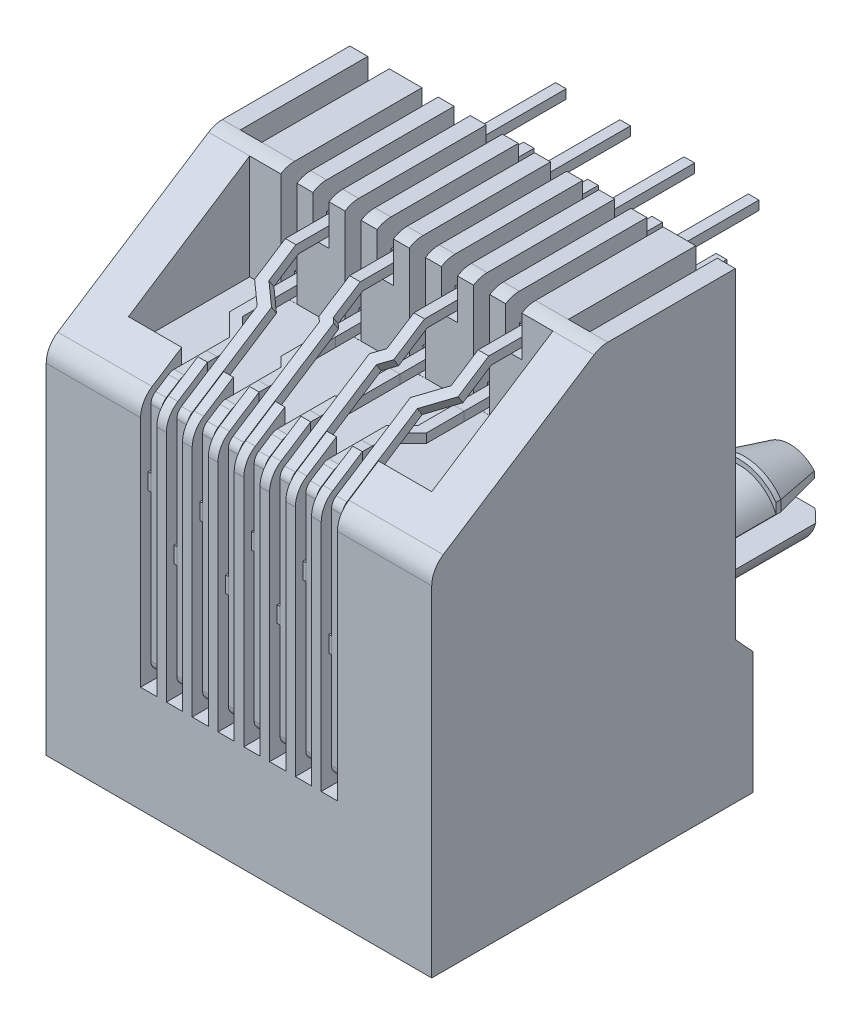
from build123d import *
from OCP.BRepFilletAPI import BRepFilletAPI_MakeChamfer

# Parameters (mm, degrees)
EXTRUDE_1_DEPTH            = 7.62
EXTRUDE_1_DEPTH_BACK       = 7.62
EXTRUDE_2_DEPTH            = 4.064
EXTRUDE_3_DEPTH            = 2
CUT_EXTRUDE_2_REACH        = 27.506
CHAMFER_1_SIZE             = 1.8
CHAMFER_1_SIZE2            = 0.482308546
CHAMFER_2_SIZE             = 0.5
SKETCH_5_W                 = 11.9888
SKETCH_5_H                 = 4.792315829
CUT_EXTRUDE_3_DEPTH        = 4.3
CUT_EXTRUDE_4_DEPTH        = 12.3878
CUT_EXTRUDE_5_DEPTH        = 2.0066
SKETCH_8_W                 = 2.3622
SKETCH_8_H                 = 4.1656
CUT_EXTRUDE_6_DEPTH        = 2.4384
CUT_EXTRUDE_7_REACH        = 25.163
SKETCH_9_W                 = 0.64
SKETCH_9_H                 = 4.297
SKETCH_9_H_2               = 1.757
CUT_EXTRUDE_8_REACH        = 27.506
SKETCH_10_W                = 0.64
SKETCH_10_H                = 10.823006421
CHAMFER_3_SIZE             = 1.03
CHAMFER_3_SIZE2            = 1.44186414
CUT_EXTRUDE_START          = -1.7272
SKETCH_11_W                = 1.1176
SKETCH_11_H                = 2.674589003
CUT_EXTRUDE_9_DEPTH        = 1.7272
SKETCH_12_W                = 2.2352
SKETCH_12_H                = 5.08
CUT_EXTRUDE_10_DEPTH       = 0.3
SKETCH_13_W                = 0.85
SKETCH_13_H                = 7.62
CUT_EXTRUDE_11_DEPTH       = 5.038415
SKETCH_14_W                = 12.7508
SKETCH_14_H                = 2.8702
CUT_EXTRUDE_12_DEPTH       = 10
EXTRUDE_4_DEPTH            = 0.15
PATTERN_LINEAR_1_COUNT     = 5
PATTERN_LINEAR_1_PITCH     = 1.02
PATTERN_LINEAR_1_COL_COUNT = 5
PATTERN_LINEAR_1_COL_PITCH = 1.02
SKETCH_16_W                = 0.1896
SKETCH_16_H                = 1.5494
EXTRUDE_5_DEPTH            = 8.7048
SKETCH_17_W                = 1.7898
SKETCH_17_H                = 1.0541
EXTRUDE_6_DEPTH            = 2.3878
CUT_EXTRUDE_START_2        = 9.5
SKETCH_19_W                = 0.64
SKETCH_19_H                = 0.9652
CUT_EXTRUDE_13_DEPTH       = 1.5
EXTRUDE_START              = 2.55
EXTRUDE_11_DEPTH           = 0.21
PATTERN_LINEAR_2_COUNT     = 4
PATTERN_LINEAR_2_PITCH     = 2.04
EXTRUDE_12_DEPTH           = 0.18
EXTRUDE_12_2_DEPTH         = 0.18
EXTRUDE_12_3_DEPTH         = 0.18
EXTRUDE_12_4_DEPTH         = 0.18
EXTRUDE_15_DEPTH           = 0.18
EXTRUDE_15_2_DEPTH         = 0.18
EXTRUDE_15_3_DEPTH         = 0.18
EXTRUDE_15_4_DEPTH         = 0.18
EXTRUDE_START_2            = -3.57
EXTRUDE_16_DEPTH           = 0.21
PATTERN_LINEAR_3_COUNT     = 4
PATTERN_LINEAR_3_PITCH     = 2.04
EXTRUDE_17_DEPTH           = 0.21
PATTERN_LINEAR_4_COUNT     = 4
PATTERN_LINEAR_4_PITCH     = 2.54
EXTRUDE_18_DEPTH           = 0.36
SKETCH_27_W                = 0.64
SKETCH_27_H                = 0.64
EXTRUDE_20_DEPTH           = 0.36
EXTRUDE_20_2_DEPTH         = 0.36
EXTRUDE_20_3_DEPTH         = 0.36
EXTRUDE_20_4_DEPTH         = 0.36
SKETCH_28_W                = 0.64
SKETCH_28_H                = 0.64
EXTRUDE_22_DEPTH           = 0.36
EXTRUDE_22_2_DEPTH         = 0.36
EXTRUDE_22_3_DEPTH         = 0.36
EXTRUDE_22_4_DEPTH         = 0.36
EXTRUDE_22_5_DEPTH         = 0.36
EXTRUDE_22_6_DEPTH         = 0.36
EXTRUDE_22_7_DEPTH         = 0.36
EXTRUDE_22_8_DEPTH         = 0.36
EXTRUDE_23_DEPTH           = 4.572


with BuildPart() as part:
    # Эскиз1 → Бобышка-Вытянуть1 (new, two sides: drawn at the far end of the back side and taken through both)
    with BuildSketch(Plane(origin=(0, 0, 0), x_dir=(0, 0, -1), z_dir=(1, 0, 0)).offset(-EXTRUDE_1_DEPTH_BACK)):
        with BuildLine():
            Line((0, 0), (-12.7, 0))
            Line((-12.7, 0), (-12.7, 13.426295429))
            ThreePointArc((-12.7, 13.426295429), (-12.578541079, 13.90396223), (-12.243668856, 14.265595242))
            Line((-12.243668856, 14.265595242), (-6.282084171, 18.127299813))
            ThreePointArc((-6.282084171, 18.127299813), (-6.021876236, 18.246983788), (-5.738415315, 18.288))
            Line((-5.738415315, 18.288), (-0.7, 18.288))
            Line((-0.7, 18.288), (-0.7, 5.588))
            Line((-0.7, 5.588), (0, 4.826))
            Line((0, 4.826), (0, 0))
        make_face()
    extrude(amount=EXTRUDE_1_DEPTH + EXTRUDE_1_DEPTH_BACK)

    # Эскиз2 → Бобышка-Вытянуть2 (add)
    with BuildSketch(Plane(origin=(0, 0, 0.7), x_dir=(-1, 0, 0), z_dir=(0, 0, -1))):
        with BuildLine():
            ThreePointArc((-7.165, 7.386081306), (-5.715, 6.426), (-4.265, 7.386081306))
            ThreePointArc((-4.265, 7.386081306), (-5.715, 9.576), (-7.165, 7.386081306))
        make_face()
        with BuildLine():
            ThreePointArc((4.265, 7.386081306), (5.715, 6.426), (7.165, 7.386081306))
            ThreePointArc((7.165, 7.386081306), (5.715, 9.576), (4.265, 7.386081306))
        make_face()
    extrude(amount=EXTRUDE_2_DEPTH)

    # Эскиз3 → Бобышка-Вытянуть3 (add)
    with BuildSketch(Plane(origin=(0, 0, -3.364), x_dir=(-1, 0, 0), z_dir=(0, 0, -1))):
        with BuildLine():
            Line((-7.49, 8.001), (-5.715, 8.001))
            Line((-5.715, 8.001), (-3.94, 8.001))
            ThreePointArc((-3.94, 8.001), (-5.715, 9.776), (-7.49, 8.001))
        make_face()
        with BuildLine():
            Line((5.715, 8.001), (3.94, 8.001))
            ThreePointArc((3.94, 8.001), (5.715, 9.776), (7.49, 8.001))
            Line((7.49, 8.001), (5.715, 8.001))
        make_face()
    extrude(amount=-EXTRUDE_3_DEPTH)

    # Вырез-Вытянуть2: up to this face of the body (flat: up to its plane)
    cut_extrude_2_end = Plane(part.part.faces().sort_by_distance((0, 12.282809859, 0.7))[0])
    # Эскиз4 → Вырез-Вытянуть2 (cut, up to the picked face)
    with BuildSketch(Plane(origin=(0, 0, -3.364), x_dir=(-1, 0, 0), z_dir=(0, 0, -1)), mode=Mode.PRIVATE) as cut_extrude_2_sk1:
        Polygon((7.62, 7.601), (7.238359774, 7.601), (4.191640226, 7.601), (3.760512716, 7.601), (3.760512716, 9.536231902), (4.265, 9.536231902), (4.265, 8.601), (7.165, 8.601), (7.165, 9.776), (7.62, 9.776), align=None)
    cut_extrude_2_tool1 = split(extrude(cut_extrude_2_sk1.sketch, amount=-CUT_EXTRUDE_2_REACH, mode=Mode.PRIVATE), bisect_by=cut_extrude_2_end, keep=Keep.BOTH, mode=Mode.PRIVATE)
    # Эскиз4 → Вырез-Вытянуть2 (cut, up to the picked face)
    with BuildSketch(Plane(origin=(0, 0, -3.364), x_dir=(-1, 0, 0), z_dir=(0, 0, -1)), mode=Mode.PRIVATE) as cut_extrude_2_sk2:
        Polygon((-7.238359774, 7.601), (-4.191640226, 7.601), (-3.760512716, 7.601), (-3.760512716, 9.536231902), (-4.265, 9.536231902), (-4.265, 8.601), (-7.165, 8.601), (-7.165, 9.776), (-7.62, 9.776), (-7.62, 7.601), align=None)
    cut_extrude_2_tool2 = split(extrude(cut_extrude_2_sk2.sketch, amount=-CUT_EXTRUDE_2_REACH, mode=Mode.PRIVATE), bisect_by=cut_extrude_2_end, keep=Keep.BOTH, mode=Mode.PRIVATE)
    add(cut_extrude_2_tool1.solids().sort_by(Axis((-5.714629, 8.314307, -3.364), (0, 0, 1)))[0], mode=Mode.SUBTRACT)
    add(cut_extrude_2_tool2.solids().sort_by(Axis((5.714629, 8.314307, -3.364), (0, 0, 1)))[0], mode=Mode.SUBTRACT)

    # Фаска1: one chamfer whose edges measure the first distance from different faces: ONE call of the kernel's chamfer builder (chamfer() names one face for all edges)
    chamfer_1_edges_1 = [part.edges().sort_by_distance(p)[0] for p in [
        (-5.715, 9.776, -3.364),
    ]]
    chamfer_1_side_1 = [part.faces().sort_by_distance(p)[0] for p in [
        (-5.715, 9.776, -2.364),
    ]]
    chamfer_1_edges_2 = [part.edges().sort_by_distance(p)[0] for p in [
        (-7.165, 8.812889881, -3.364),
    ]]
    chamfer_1_side_2 = [part.faces().sort_by_distance(p)[0] for p in [
        (-7.165, 8.805723204, -2.29276462),
    ]]
    chamfer_1_edges_3 = [part.edges().sort_by_distance(p)[0] for p in [
        (-4.265, 8.812889881, -3.364),
    ]]
    chamfer_1_side_3 = [part.faces().sort_by_distance(p)[0] for p in [
        (-4.265, 8.805723204, -2.29276462),
    ]]
    chamfer_1_edges_4 = [part.edges().sort_by_distance(p)[0] for p in [
        (5.715, 9.776, -3.364),
    ]]
    chamfer_1_side_4 = [part.faces().sort_by_distance(p)[0] for p in [
        (5.715, 9.776, -2.364),
    ]]
    chamfer_1_edges_5 = [part.edges().sort_by_distance(p)[0] for p in [
        (4.265, 8.812889881, -3.364),
    ]]
    chamfer_1_side_5 = [part.faces().sort_by_distance(p)[0] for p in [
        (4.265, 8.805723204, -2.29276462),
    ]]
    chamfer_1_edges_6 = [part.edges().sort_by_distance(p)[0] for p in [
        (7.165, 8.812889881, -3.364),
    ]]
    chamfer_1_side_6 = [part.faces().sort_by_distance(p)[0] for p in [
        (7.165, 8.805723204, -2.29276462),
    ]]
    chamfer_1 = BRepFilletAPI_MakeChamfer(part.part.solid().wrapped)
    for e in chamfer_1_edges_1:
        chamfer_1.Add(CHAMFER_1_SIZE, CHAMFER_1_SIZE2, e.wrapped, chamfer_1_side_1[0].wrapped)  # the first distance lies on this face
    for e in chamfer_1_edges_2:
        chamfer_1.Add(CHAMFER_1_SIZE, CHAMFER_1_SIZE2, e.wrapped, chamfer_1_side_2[0].wrapped)  # the first distance lies on this face
    for e in chamfer_1_edges_3:
        chamfer_1.Add(CHAMFER_1_SIZE, CHAMFER_1_SIZE2, e.wrapped, chamfer_1_side_3[0].wrapped)  # the first distance lies on this face
    for e in chamfer_1_edges_4:
        chamfer_1.Add(CHAMFER_1_SIZE, CHAMFER_1_SIZE2, e.wrapped, chamfer_1_side_4[0].wrapped)  # the first distance lies on this face
    for e in chamfer_1_edges_5:
        chamfer_1.Add(CHAMFER_1_SIZE, CHAMFER_1_SIZE2, e.wrapped, chamfer_1_side_5[0].wrapped)  # the first distance lies on this face
    for e in chamfer_1_edges_6:
        chamfer_1.Add(CHAMFER_1_SIZE, CHAMFER_1_SIZE2, e.wrapped, chamfer_1_side_6[0].wrapped)  # the first distance lies on this face
    add(Compound.cast(chamfer_1.Shape()), mode=Mode.REPLACE)

    # Фаска2
    chamfer_2_edges = [part.edges().sort_by_distance(p)[0] for p in [
        (-5.715, 6.426, -3.364),
        (5.715, 6.426, -3.364),
    ]]
    chamfer(chamfer_2_edges, length=CHAMFER_2_SIZE)

    # Эскиз5 → Вырез-Вытянуть3 (cut)
    with BuildSketch(Plane(origin=(0, 18.288, 0), x_dir=(1, 0, 0), z_dir=(0, 1, 0))):
        with Locations((0, -8.678242086)):
            Rectangle(SKETCH_5_W, SKETCH_5_H)
    extrude(amount=-CUT_EXTRUDE_3_DEPTH, mode=Mode.SUBTRACT)

    # Эскиз6 → Вырез-Вытянуть4 (cut)
    with BuildSketch(Plane.XZ):
        Polygon((-6.0198, 10.4902), (-4.4196, 10.4902), (-4.4196, 12.0396), (4.4196, 12.0396), (4.4196, 10.4902), (6.0198, 10.4902), (6.0198, 3.4036), (3.1242, 3.4036), (3.1242, 1.7272), (-3.1242, 1.7272), (-3.1242, 3.4036), (-6.0198, 3.4036), align=None)
    extrude(amount=-CUT_EXTRUDE_4_DEPTH, mode=Mode.SUBTRACT)

    # Эскиз7 → Вырез-Вытянуть5 (cut, symmetric)
    with BuildSketch(Plane(origin=(0, 0, 0), x_dir=(0, 0, -1), z_dir=(1, 0, 0))):
        Polygon((-0.5842, 1.524), (-0.5842, 2.909935566), (-1.7272, 7.4168), (-1.7272, 0), (-0.3302, 0), align=None)
    extrude(amount=CUT_EXTRUDE_5_DEPTH, both=True, mode=Mode.SUBTRACT)

    # Эскиз8 → Вырез-Вытянуть6 (cut)
    with BuildSketch(Plane(origin=(0, 0, 0), x_dir=(-1, 0, 0), z_dir=(0, 0, -1))):
        with Locations((5.4737, 3.5052)):
            Rectangle(SKETCH_8_W, SKETCH_8_H)
        with Locations((-5.4737, 3.5052)):
            Rectangle(SKETCH_8_W, SKETCH_8_H)
    extrude(amount=-CUT_EXTRUDE_6_DEPTH, mode=Mode.SUBTRACT)

    # Вырез-Вытянуть7: up to this face of the body (flat: up to its plane)
    cut_extrude_7_end = Plane(part.part.faces().sort_by_distance((0, 16.057649906, 6.282084171))[0])
    # Эскиз9 → Вырез-Вытянуть7 (cut, up to the picked face)
    with BuildSketch(Plane(origin=(0, 0, 0.7), x_dir=(-1, 0, 0), z_dir=(0, 0, -1)), mode=Mode.PRIVATE) as cut_extrude_7_sk1:
        with Locations((-3.175, 16.1395)):
            Rectangle(SKETCH_9_W, SKETCH_9_H)
    cut_extrude_7_tool1 = split(extrude(cut_extrude_7_sk1.sketch, amount=-CUT_EXTRUDE_7_REACH, mode=Mode.PRIVATE), bisect_by=cut_extrude_7_end, keep=Keep.BOTH, mode=Mode.PRIVATE)
    # Эскиз9 → Вырез-Вытянуть7 (cut, up to the picked face)
    with BuildSketch(Plane(origin=(0, 0, 0.7), x_dir=(-1, 0, 0), z_dir=(0, 0, -1)), mode=Mode.PRIVATE) as cut_extrude_7_sk2:
        with Locations((-0.635, 16.1395)):
            Rectangle(SKETCH_9_W, SKETCH_9_H)
    cut_extrude_7_tool2 = split(extrude(cut_extrude_7_sk2.sketch, amount=-CUT_EXTRUDE_7_REACH, mode=Mode.PRIVATE), bisect_by=cut_extrude_7_end, keep=Keep.BOTH, mode=Mode.PRIVATE)
    # Эскиз9 → Вырез-Вытянуть7 (cut, up to the picked face)
    with BuildSketch(Plane(origin=(0, 0, 0.7), x_dir=(-1, 0, 0), z_dir=(0, 0, -1)), mode=Mode.PRIVATE) as cut_extrude_7_sk3:
        with Locations((1.905, 16.1395)):
            Rectangle(SKETCH_9_W, SKETCH_9_H)
    cut_extrude_7_tool3 = split(extrude(cut_extrude_7_sk3.sketch, amount=-CUT_EXTRUDE_7_REACH, mode=Mode.PRIVATE), bisect_by=cut_extrude_7_end, keep=Keep.BOTH, mode=Mode.PRIVATE)
    # Эскиз9 → Вырез-Вытянуть7 (cut, up to the picked face)
    with BuildSketch(Plane(origin=(0, 0, 0.7), x_dir=(-1, 0, 0), z_dir=(0, 0, -1)), mode=Mode.PRIVATE) as cut_extrude_7_sk4:
        with Locations((-1.905, 17.4095)):
            Rectangle(SKETCH_9_W, SKETCH_9_H_2)
    cut_extrude_7_tool4 = split(extrude(cut_extrude_7_sk4.sketch, amount=-CUT_EXTRUDE_7_REACH, mode=Mode.PRIVATE), bisect_by=cut_extrude_7_end, keep=Keep.BOTH, mode=Mode.PRIVATE)
    # Эскиз9 → Вырез-Вытянуть7 (cut, up to the picked face)
    with BuildSketch(Plane(origin=(0, 0, 0.7), x_dir=(-1, 0, 0), z_dir=(0, 0, -1)), mode=Mode.PRIVATE) as cut_extrude_7_sk5:
        with Locations((4.445, 16.1395)):
            Rectangle(SKETCH_9_W, SKETCH_9_H)
    cut_extrude_7_tool5 = split(extrude(cut_extrude_7_sk5.sketch, amount=-CUT_EXTRUDE_7_REACH, mode=Mode.PRIVATE), bisect_by=cut_extrude_7_end, keep=Keep.BOTH, mode=Mode.PRIVATE)
    # Эскиз9 → Вырез-Вытянуть7 (cut, up to the picked face)
    with BuildSketch(Plane(origin=(0, 0, 0.7), x_dir=(-1, 0, 0), z_dir=(0, 0, -1)), mode=Mode.PRIVATE) as cut_extrude_7_sk6:
        with Locations((-4.445, 17.4095)):
            Rectangle(SKETCH_9_W, SKETCH_9_H_2)
    cut_extrude_7_tool6 = split(extrude(cut_extrude_7_sk6.sketch, amount=-CUT_EXTRUDE_7_REACH, mode=Mode.PRIVATE), bisect_by=cut_extrude_7_end, keep=Keep.BOTH, mode=Mode.PRIVATE)
    # Эскиз9 → Вырез-Вытянуть7 (cut, up to the picked face)
    with BuildSketch(Plane(origin=(0, 0, 0.7), x_dir=(-1, 0, 0), z_dir=(0, 0, -1)), mode=Mode.PRIVATE) as cut_extrude_7_sk7:
        with Locations((0.635, 17.4095)):
            Rectangle(SKETCH_9_W, SKETCH_9_H_2)
    cut_extrude_7_tool7 = split(extrude(cut_extrude_7_sk7.sketch, amount=-CUT_EXTRUDE_7_REACH, mode=Mode.PRIVATE), bisect_by=cut_extrude_7_end, keep=Keep.BOTH, mode=Mode.PRIVATE)
    # Эскиз9 → Вырез-Вытянуть7 (cut, up to the picked face)
    with BuildSketch(Plane(origin=(0, 0, 0.7), x_dir=(-1, 0, 0), z_dir=(0, 0, -1)), mode=Mode.PRIVATE) as cut_extrude_7_sk8:
        with Locations((3.175, 17.4095)):
            Rectangle(SKETCH_9_W, SKETCH_9_H_2)
    cut_extrude_7_tool8 = split(extrude(cut_extrude_7_sk8.sketch, amount=-CUT_EXTRUDE_7_REACH, mode=Mode.PRIVATE), bisect_by=cut_extrude_7_end, keep=Keep.BOTH, mode=Mode.PRIVATE)
    add(cut_extrude_7_tool1.solids().sort_by(Axis((3.175, 16.1395, 0.7), (0, 0, 1)))[0], mode=Mode.SUBTRACT)
    add(cut_extrude_7_tool2.solids().sort_by(Axis((0.635, 16.1395, 0.7), (0, 0, 1)))[0], mode=Mode.SUBTRACT)
    add(cut_extrude_7_tool3.solids().sort_by(Axis((-1.905, 16.1395, 0.7), (0, 0, 1)))[0], mode=Mode.SUBTRACT)
    add(cut_extrude_7_tool4.solids().sort_by(Axis((1.905, 17.4095, 0.7), (0, 0, 1)))[0], mode=Mode.SUBTRACT)
    add(cut_extrude_7_tool5.solids().sort_by(Axis((-4.445, 16.1395, 0.7), (0, 0, 1)))[0], mode=Mode.SUBTRACT)
    add(cut_extrude_7_tool6.solids().sort_by(Axis((4.445, 17.4095, 0.7), (0, 0, 1)))[0], mode=Mode.SUBTRACT)
    add(cut_extrude_7_tool7.solids().sort_by(Axis((-0.635, 17.4095, 0.7), (0, 0, 1)))[0], mode=Mode.SUBTRACT)
    add(cut_extrude_7_tool8.solids().sort_by(Axis((-3.175, 17.4095, 0.7), (0, 0, 1)))[0], mode=Mode.SUBTRACT)

    # Вырез-Вытянуть8: up to this face of the body (flat: up to its plane)
    cut_extrude_8_end = Plane(part.part.faces().sort_by_distance((0, 6.1939, 12.0396))[0])
    # Эскиз10 → Вырез-Вытянуть8 (cut, up to the picked face)
    with BuildSketch(Plane.XY.offset(12.7), mode=Mode.PRIVATE) as cut_extrude_8_sk1:
        with Locations((-3.57, 9.611503211)):
            Rectangle(SKETCH_10_W, SKETCH_10_H)
    cut_extrude_8_tool1 = split(extrude(cut_extrude_8_sk1.sketch, amount=-CUT_EXTRUDE_8_REACH, mode=Mode.PRIVATE), bisect_by=cut_extrude_8_end, keep=Keep.BOTH, mode=Mode.PRIVATE)
    # Эскиз10 → Вырез-Вытянуть8 (cut, up to the picked face)
    with BuildSketch(Plane.XY.offset(12.7), mode=Mode.PRIVATE) as cut_extrude_8_sk2:
        with Locations((-2.55, 9.611503211)):
            Rectangle(SKETCH_10_W, SKETCH_10_H)
    cut_extrude_8_tool2 = split(extrude(cut_extrude_8_sk2.sketch, amount=-CUT_EXTRUDE_8_REACH, mode=Mode.PRIVATE), bisect_by=cut_extrude_8_end, keep=Keep.BOTH, mode=Mode.PRIVATE)
    # Эскиз10 → Вырез-Вытянуть8 (cut, up to the picked face)
    with BuildSketch(Plane.XY.offset(12.7), mode=Mode.PRIVATE) as cut_extrude_8_sk3:
        with Locations((-1.53, 9.611503211)):
            Rectangle(SKETCH_10_W, SKETCH_10_H)
    cut_extrude_8_tool3 = split(extrude(cut_extrude_8_sk3.sketch, amount=-CUT_EXTRUDE_8_REACH, mode=Mode.PRIVATE), bisect_by=cut_extrude_8_end, keep=Keep.BOTH, mode=Mode.PRIVATE)
    # Эскиз10 → Вырез-Вытянуть8 (cut, up to the picked face)
    with BuildSketch(Plane.XY.offset(12.7), mode=Mode.PRIVATE) as cut_extrude_8_sk4:
        with Locations((-0.51, 9.611503211)):
            Rectangle(SKETCH_10_W, SKETCH_10_H)
    cut_extrude_8_tool4 = split(extrude(cut_extrude_8_sk4.sketch, amount=-CUT_EXTRUDE_8_REACH, mode=Mode.PRIVATE), bisect_by=cut_extrude_8_end, keep=Keep.BOTH, mode=Mode.PRIVATE)
    # Эскиз10 → Вырез-Вытянуть8 (cut, up to the picked face)
    with BuildSketch(Plane.XY.offset(12.7), mode=Mode.PRIVATE) as cut_extrude_8_sk5:
        with Locations((0.51, 9.611503211)):
            Rectangle(SKETCH_10_W, SKETCH_10_H)
    cut_extrude_8_tool5 = split(extrude(cut_extrude_8_sk5.sketch, amount=-CUT_EXTRUDE_8_REACH, mode=Mode.PRIVATE), bisect_by=cut_extrude_8_end, keep=Keep.BOTH, mode=Mode.PRIVATE)
    # Эскиз10 → Вырез-Вытянуть8 (cut, up to the picked face)
    with BuildSketch(Plane.XY.offset(12.7), mode=Mode.PRIVATE) as cut_extrude_8_sk6:
        with Locations((1.53, 9.611503211)):
            Rectangle(SKETCH_10_W, SKETCH_10_H)
    cut_extrude_8_tool6 = split(extrude(cut_extrude_8_sk6.sketch, amount=-CUT_EXTRUDE_8_REACH, mode=Mode.PRIVATE), bisect_by=cut_extrude_8_end, keep=Keep.BOTH, mode=Mode.PRIVATE)
    # Эскиз10 → Вырез-Вытянуть8 (cut, up to the picked face)
    with BuildSketch(Plane.XY.offset(12.7), mode=Mode.PRIVATE) as cut_extrude_8_sk7:
        with Locations((2.55, 9.611503211)):
            Rectangle(SKETCH_10_W, SKETCH_10_H)
    cut_extrude_8_tool7 = split(extrude(cut_extrude_8_sk7.sketch, amount=-CUT_EXTRUDE_8_REACH, mode=Mode.PRIVATE), bisect_by=cut_extrude_8_end, keep=Keep.BOTH, mode=Mode.PRIVATE)
    # Эскиз10 → Вырез-Вытянуть8 (cut, up to the picked face)
    with BuildSketch(Plane.XY.offset(12.7), mode=Mode.PRIVATE) as cut_extrude_8_sk8:
        with Locations((3.57, 9.611503211)):
            Rectangle(SKETCH_10_W, SKETCH_10_H)
    cut_extrude_8_tool8 = split(extrude(cut_extrude_8_sk8.sketch, amount=-CUT_EXTRUDE_8_REACH, mode=Mode.PRIVATE), bisect_by=cut_extrude_8_end, keep=Keep.BOTH, mode=Mode.PRIVATE)
    add(cut_extrude_8_tool1.solids().sort_by(Axis((-3.57, 9.611503, 12.7), (0, 0, -1)))[0], mode=Mode.SUBTRACT)
    add(cut_extrude_8_tool2.solids().sort_by(Axis((-2.55, 9.611503, 12.7), (0, 0, -1)))[0], mode=Mode.SUBTRACT)
    add(cut_extrude_8_tool3.solids().sort_by(Axis((-1.53, 9.611503, 12.7), (0, 0, -1)))[0], mode=Mode.SUBTRACT)
    add(cut_extrude_8_tool4.solids().sort_by(Axis((-0.51, 9.611503, 12.7), (0, 0, -1)))[0], mode=Mode.SUBTRACT)
    add(cut_extrude_8_tool5.solids().sort_by(Axis((0.51, 9.611503, 12.7), (0, 0, -1)))[0], mode=Mode.SUBTRACT)
    add(cut_extrude_8_tool6.solids().sort_by(Axis((1.53, 9.611503, 12.7), (0, 0, -1)))[0], mode=Mode.SUBTRACT)
    add(cut_extrude_8_tool7.solids().sort_by(Axis((2.55, 9.611503, 12.7), (0, 0, -1)))[0], mode=Mode.SUBTRACT)
    add(cut_extrude_8_tool8.solids().sort_by(Axis((3.57, 9.611503, 12.7), (0, 0, -1)))[0], mode=Mode.SUBTRACT)

    # Фаска3
    chamfer_3_edges = [part.edges().sort_by_distance(p)[0] for p in [
        (0, 4.826, 0),
    ]]
    chamfer_3_side = [part.faces().sort_by_distance(p)[0] for p in [
        (0, 5.207, 0.35),
    ]]
    chamfer(chamfer_3_edges, length=CHAMFER_3_SIZE, length2=CHAMFER_3_SIZE2, reference=chamfer_3_side[0])

    # Эскиз11 → Вырез-Вытянуть9 (cut)
    with BuildSketch(Plane(origin=(0, 0, 0), x_dir=(-1, 0, 0), z_dir=(0, 0, -1)).offset(CUT_EXTRUDE_START)):
        with Locations((-2.5654, 4.247230068)):
            Rectangle(SKETCH_11_W, SKETCH_11_H)
        with Locations((2.5654, 4.247230068)):
            Rectangle(SKETCH_11_W, SKETCH_11_H)
    extrude(amount=CUT_EXTRUDE_9_DEPTH, mode=Mode.SUBTRACT)

    # Эскиз12 → Вырез-Вытянуть10 (cut)
    with BuildSketch(Plane(origin=(0, 0, 0.7), x_dir=(-1, 0, 0), z_dir=(0, 0, -1))):
        with Locations((-2.24, 10.668)):
            Rectangle(SKETCH_12_W, SKETCH_12_H)
        with Locations((2.24, 10.668)):
            Rectangle(SKETCH_12_W, SKETCH_12_H)
    extrude(amount=-CUT_EXTRUDE_10_DEPTH, mode=Mode.SUBTRACT)

    # Эскиз13 → Вырез-Вытянуть11 (cut)
    with BuildSketch(Plane(origin=(0, 0, 0.7), x_dir=(-1, 0, 0), z_dir=(0, 0, -1))):
        with Locations((-6.4838, 14.478)):
            Rectangle(SKETCH_13_W, SKETCH_13_H)
        with Locations((6.4838, 14.478)):
            Rectangle(SKETCH_13_W, SKETCH_13_H)
    extrude(amount=-CUT_EXTRUDE_11_DEPTH, mode=Mode.SUBTRACT)

    # Эскиз14 → Вырез-Вытянуть12 (cut)
    with BuildSketch(Plane.XZ):
        with Locations((0, 6.9469)):
            Rectangle(SKETCH_14_W, SKETCH_14_H)
    extrude(amount=-CUT_EXTRUDE_12_DEPTH, mode=Mode.SUBTRACT)

    # Эскиз15 → Бобышка-Вытянуть4 (add, symmetric)
    with BuildSketch(Plane(origin=(0, 0, 0), x_dir=(0, 0, -1), z_dir=(1, 0, 0))):
        Polygon((-12.04232442, 3.683), (-10.4902, 3.683), (-10.4902, 10.83567558), (-6.5118, 10.83567558), (-6.5118, 12.3878), (-12.0396, 12.3878), align=None)
    extrude_4 = extrude(amount=EXTRUDE_4_DEPTH, both=True)

    # Линейный массив1: Бобышка-Вытянуть4 ×5
    with Locations(*[(i * PATTERN_LINEAR_1_PITCH, 0, 0) for i in range(1, PATTERN_LINEAR_1_COUNT)]):
        add(extrude_4)

    # Линейный массив1 col: Бобышка-Вытянуть4 ×5
    with Locations(*[(-i * PATTERN_LINEAR_1_COL_PITCH, 0, 0) for i in range(1, PATTERN_LINEAR_1_COL_COUNT)]):
        add(extrude_4)

    # Эскиз16 → Бобышка-Вытянуть5 (add)
    with BuildSketch(Plane.XZ.offset(-3.683)):
        with Locations((4.3248, 11.2649)):
            Rectangle(SKETCH_16_W, SKETCH_16_H)
        with Locations((-4.3248, 11.2649)):
            Rectangle(SKETCH_16_W, SKETCH_16_H)
    extrude(amount=-EXTRUDE_5_DEPTH)

    # Эскиз17 → Бобышка-Вытянуть6 (add)
    with BuildSketch(Plane.XZ.offset(-10)):
        with Locations((5.1249, 3.93065)):
            Rectangle(SKETCH_17_W, SKETCH_17_H)
        with Locations((-5.1249, 3.93065)):
            Rectangle(SKETCH_17_W, SKETCH_17_H)
    extrude(amount=-EXTRUDE_6_DEPTH)

    # Эскиз19 → Вырез-Вытянуть13 (cut)
    with BuildSketch(Plane(origin=(0, 4.2, 0), x_dir=(1, 0, 0), z_dir=(0, 1, 0)).offset(CUT_EXTRUDE_START_2)):
        with Locations((-3.57, -11.557)):
            Rectangle(SKETCH_19_W, SKETCH_19_H)
        with Locations((-2.55, -11.557)):
            Rectangle(SKETCH_19_W, SKETCH_19_H)
        with Locations((-1.53, -11.557)):
            Rectangle(SKETCH_19_W, SKETCH_19_H)
        with Locations((-0.51, -11.557)):
            Rectangle(SKETCH_19_W, SKETCH_19_H)
        with Locations((0.51, -11.557)):
            Rectangle(SKETCH_19_W, SKETCH_19_H)
        with Locations((1.53, -11.557)):
            Rectangle(SKETCH_19_W, SKETCH_19_H)
        with Locations((2.55, -11.557)):
            Rectangle(SKETCH_19_W, SKETCH_19_H)
        with Locations((3.57, -11.557)):
            Rectangle(SKETCH_19_W, SKETCH_19_H)
    extrude(amount=CUT_EXTRUDE_13_DEPTH, mode=Mode.SUBTRACT)


with BuildPart() as body_2:
    # Эскиз20 → Бобышка-Вытянуть11 (new, symmetric)
    with BuildSketch(Plane(origin=(0, 0, 0), x_dir=(0, 0, -1), z_dir=(1, 0, 0)).offset(EXTRUDE_START)):
        with BuildLine():
            Line((-12.016783443, 13.83436286), (-11.509497245, 14.162964991))
            ThreePointArc((-11.509497245, 14.162964991), (-11.496486848, 14.168949189), (-11.482313802, 14.171))
            Line((-11.482313802, 14.171), (-10.2, 14.171))
            Line((-10.2, 14.171), (-10.2, 14.531))
            Line((-10.2, 14.531), (-11.482313802, 14.531))
            ThreePointArc((-11.482313802, 14.531), (-11.59853278, 14.514183353), (-11.705218033, 14.465112923))
            Line((-11.705218033, 14.465112923), (-12.212504231, 14.136510793))
            ThreePointArc((-12.212504231, 14.136510793), (-12.349801842, 13.988241258), (-12.3996, 13.792397869))
            Line((-12.3996, 13.792397869), (-12.3996, 4.99660254))
            ThreePointArc((-12.3996, 4.99660254), (-12.095715808, 4.600572952), (-11.634529584, 4.79160254))
            Line((-11.634529584, 4.79160254), (-7.352785985, 12.2078))
            Line((-7.352785985, 12.2078), (-7.66455513, 12.3878))
            Line((-7.66455513, 12.3878), (-11.94629873, 4.97160254))
            ThreePointArc((-11.94629873, 4.97160254), (-12.002540952, 4.948306249), (-12.0396, 4.99660254))
            Line((-12.0396, 4.99660254), (-12.0396, 13.792397869))
            ThreePointArc((-12.0396, 13.792397869), (-12.033527054, 13.816281209), (-12.016783443, 13.83436286))
        make_face()
    extrude_11 = extrude(amount=EXTRUDE_11_DEPTH, both=True)


with BuildPart() as pattern_linear_2_1:
    # Линейный массив2: Бобышка-Вытянуть11 ×4
    with Locations(*[(-i * PATTERN_LINEAR_2_PITCH, 0, 0) for i in range(1, PATTERN_LINEAR_2_COUNT)]):
        add(extrude_11)


with BuildPart() as body_6:
    # Эскиз21 → Бобышка-Вытянуть12 (new, symmetric)
    with BuildSketch(Plane(origin=(0, 14.351, 0), x_dir=(1, 0, 0), z_dir=(0, 1, 0))):
        Polygon((2.965, 3.2), (3.385, 3.2), (3.385, -5.098415315), (3.495, -5.098415315), (3.495, -5.738415315), (3.385, -5.738415315), (3.385, -7.282084171), (2.965, -7.282084171), (2.965, -5.738415315), (2.855, -5.738415315), (2.855, -5.098415315), (2.965, -5.098415315), align=None)
    extrude(amount=EXTRUDE_12_DEPTH, both=True)


with BuildPart() as body_7:
    # Эскиз21 → Extrude 12 2 (new, symmetric)
    with BuildSketch(Plane(origin=(0, 14.351, 0), x_dir=(1, 0, 0), z_dir=(0, 1, 0))):
        Polygon((0.425, 3.2), (0.845, 3.2), (0.845, -5.098415315), (0.955, -5.098415315), (0.955, -5.738415315), (0.845, -5.738415315), (0.845, -7.282084171), (0.425, -7.282084171), (0.425, -5.738415315), (0.315, -5.738415315), (0.315, -5.098415315), (0.425, -5.098415315), align=None)
    extrude(amount=EXTRUDE_12_2_DEPTH, both=True)


with BuildPart() as body_8:
    # Эскиз21 → Extrude 12 3 (new, symmetric)
    with BuildSketch(Plane(origin=(0, 14.351, 0), x_dir=(1, 0, 0), z_dir=(0, 1, 0))):
        Polygon((-2.115, 3.2), (-1.695, 3.2), (-1.695, -5.098415315), (-1.585, -5.098415315), (-1.585, -5.738415315), (-1.695, -5.738415315), (-1.695, -7.282084171), (-2.115, -7.282084171), (-2.115, -5.738415315), (-2.225, -5.738415315), (-2.225, -5.098415315), (-2.115, -5.098415315), align=None)
    extrude(amount=EXTRUDE_12_3_DEPTH, both=True)


with BuildPart() as body_9:
    # Эскиз21 → Extrude 12 4 (new, symmetric)
    with BuildSketch(Plane(origin=(0, 14.351, 0), x_dir=(1, 0, 0), z_dir=(0, 1, 0))):
        Polygon((-4.655, 3.2), (-4.235, 3.2), (-4.235, -5.098415315), (-4.125, -5.098415315), (-4.125, -5.738415315), (-4.235, -5.738415315), (-4.235, -7.282084171), (-4.655, -7.282084171), (-4.655, -5.738415315), (-4.765, -5.738415315), (-4.765, -5.098415315), (-4.655, -5.098415315), align=None)
    extrude(amount=EXTRUDE_12_4_DEPTH, both=True)


with BuildPart() as body_10:
    # Эскиз22 → Бобышка-Вытянуть15 (new, symmetric)
    with BuildSketch(Plane(origin=(0, 14.351, 0), x_dir=(1, 0, 0), z_dir=(0, 1, 0))):
        Polygon((2.34, -10.3), (2.34, -9.2), (2.965, -8.575), (2.965, -7.182084171), (3.385, -7.182084171), (3.385, -8.664116882), (2.76, -9.289116882), (2.76, -10.3), align=None)
    extrude(amount=EXTRUDE_15_DEPTH, both=True)


with BuildPart() as body_11:
    # Эскиз22 → Extrude 15 2 (new, symmetric)
    with BuildSketch(Plane(origin=(0, 14.351, 0), x_dir=(1, 0, 0), z_dir=(0, 1, 0))):
        Polygon((0.3, -10.3), (0.3, -9.217432357), (0.425, -9.092432357), (0.425, -7.182084171), (0.845, -7.182084171), (0.845, -9.18154924), (0.72, -9.30654924), (0.72, -10.3), align=None)
    extrude(amount=EXTRUDE_15_2_DEPTH, both=True)


with BuildPart() as body_12:
    # Эскиз22 → Extrude 15 3 (new, symmetric)
    with BuildSketch(Plane(origin=(0, 14.351, 0), x_dir=(1, 0, 0), z_dir=(0, 1, 0))):
        Polygon((-1.32, -10.3), (-1.32, -9.2), (-1.695, -8.825), (-1.695, -7.182084171), (-2.115, -7.182084171), (-2.115, -8.914116882), (-1.74, -9.289116882), (-1.74, -10.3), align=None)
    extrude(amount=EXTRUDE_15_3_DEPTH, both=True)


with BuildPart() as body_13:
    # Эскиз22 → Extrude 15 4 (new, symmetric)
    with BuildSketch(Plane(origin=(0, 14.351, 0), x_dir=(1, 0, 0), z_dir=(0, 1, 0))):
        Polygon((-4.655, -7.182084171), (-4.235, -7.182084171), (-4.235, -8.325), (-3.36, -9.2), (-3.36, -10.3), (-3.78, -10.3), (-3.78, -9.289116882), (-4.655, -8.414116882), align=None)
    extrude(amount=EXTRUDE_15_4_DEPTH, both=True)


with BuildPart() as body_14:
    # Эскиз23 → Бобышка-Вытянуть16 (new, symmetric)
    with BuildSketch(Plane.ZY.offset(EXTRUDE_START_2)):
        with BuildLine():
            Line((12.212504231, 14.136510793), (10.114254699, 15.495682932))
            Line((10.114254699, 15.495682932), (9.918533911, 15.193534999))
            Line((9.918533911, 15.193534999), (12.016783443, 13.83436286))
            ThreePointArc((12.016783443, 13.83436286), (12.033527054, 13.816281209), (12.0396, 13.792397869))
            Line((12.0396, 13.792397869), (12.0396, 13.7))
            Line((12.0396, 13.7), (12.0396, 4.99660254))
            ThreePointArc((12.0396, 4.99660254), (12.002540952, 4.948306249), (11.94629873, 4.97160254))
            Line((11.94629873, 4.97160254), (7.66455513, 12.3878))
            Line((7.66455513, 12.3878), (7.352785985, 12.2078))
            Line((7.352785985, 12.2078), (11.634529584, 4.79160254))
            ThreePointArc((11.634529584, 4.79160254), (12.095715808, 4.600572952), (12.3996, 4.99660254))
            Line((12.3996, 4.99660254), (12.3996, 13.792397869))
            ThreePointArc((12.3996, 13.792397869), (12.349801842, 13.988241258), (12.212504231, 14.136510793))
        make_face()
    extrude_16 = extrude(amount=EXTRUDE_16_DEPTH, both=True)



with BuildPart() as pattern_linear_3_1:
    # Линейный массив3: pattern copy
    add(extrude_16.moved(Location(Vector(-1, 0, 0) * (1 * PATTERN_LINEAR_3_PITCH))))


with BuildPart() as pattern_linear_3_2:
    # Линейный массив3: pattern copy
    add(extrude_16.moved(Location(Vector(-1, 0, 0) * (2 * PATTERN_LINEAR_3_PITCH))))


with BuildPart() as pattern_linear_3_3:
    # Линейный массив3: pattern copy
    add(extrude_16.moved(Location(Vector(-1, 0, 0) * (3 * PATTERN_LINEAR_3_PITCH))))


with BuildPart() as body_18:
    # Эскиз25 → Бобышка-Вытянуть17 (new, symmetric)
    with BuildSketch(Plane(origin=(4.445, 0, 0), x_dir=(0, 0, -1), z_dir=(1, 0, 0))):
        Polygon((-7.373631275, 16.842033286), (-7.904211028, 16.498342411), (-8.099931816, 16.800490344), (-7.480041762, 17.202033286), (3.2, 17.202033286), (3.2, 16.842033286), align=None)
    extrude_17 = extrude(amount=EXTRUDE_17_DEPTH, both=True)


with BuildPart() as pattern_linear_4_1:
    # Линейный массив4: pattern copy
    add(extrude_17.moved(Location(Vector(-1, 0, 0) * (1 * PATTERN_LINEAR_4_PITCH))))


with BuildPart() as pattern_linear_4_2:
    # Линейный массив4: pattern copy
    add(extrude_17.moved(Location(Vector(-1, 0, 0) * (2 * PATTERN_LINEAR_4_PITCH))))


with BuildPart() as pattern_linear_4_3:
    # Линейный массив4: pattern copy
    add(extrude_17.moved(Location(Vector(-1, 0, 0) * (3 * PATTERN_LINEAR_4_PITCH))))


with BuildPart() as body_14_1:
    add(body_14.part)

    add(pattern_linear_3_1.part)  # Бобышка-Вытянуть18 merges Линейный массив3_1

    add(pattern_linear_3_2.part)  # Бобышка-Вытянуть18 merges Линейный массив3_2

    add(pattern_linear_3_3.part)  # Бобышка-Вытянуть18 merges Линейный массив3_3

    add(body_18.part)  # Бобышка-Вытянуть18 merges body 18

    add(pattern_linear_4_1.part)  # Бобышка-Вытянуть18 merges Линейный массив4_1

    add(pattern_linear_4_2.part)  # Бобышка-Вытянуть18 merges Линейный массив4_2

    add(pattern_linear_4_3.part)  # Бобышка-Вытянуть18 merges Линейный массив4_3
    # Эскиз26 → Бобышка-Вытянуть18 (add)
    with BuildSketch(Plane(origin=(0, 15.530679912, 10.060227402), x_dir=(1, 0, 0), z_dir=(0, 0.8392998126511051, 0.543668855539675))):
        Polygon((3.36, -0.164371869), (3.78, -0.164371869), (3.78, 0.750632102), (4.655, 1.625632102), (4.655, 2.435632102), (4.235, 2.435632102), (4.235, 1.799601799), (3.36, 0.924601799), align=None)
        Polygon((1.74, -0.164371869), (1.32, -0.164371869), (1.32, 1.424601799), (1.695, 1.799601799), (1.695, 2.435632102), (2.115, 2.435632102), (2.115, 1.625632102), (1.74, 1.250632102), align=None)
        Polygon((-0.3, -0.164371869), (-0.72, -0.164371869), (-0.72, 1.500632102), (-0.845, 1.625632102), (-0.845, 2.435632102), (-0.425, 2.435632102), (-0.425, 1.799601799), (-0.3, 1.674601799), align=None)
        Polygon((-2.34, -0.164371869), (-2.76, -0.164371869), (-2.76, 1.000632102), (-3.385, 1.625632102), (-3.385, 2.435632102), (-2.965, 2.435632102), (-2.965, 1.799601799), (-2.34, 1.174601799), align=None)
    extrude(amount=-EXTRUDE_18_DEPTH)


with BuildPart() as body_15:
    # Эскиз27 → Бобышка-Вытянуть20 (new body)
    with BuildSketch(Plane(origin=(0, 17.202033286, 0), x_dir=(1, 0, 0), z_dir=(0, 1, 0))):
        with Locations((-3.175, -5.418415315)):
            Rectangle(SKETCH_27_W, SKETCH_27_H)
    extrude(amount=-EXTRUDE_20_DEPTH)


with BuildPart() as body_16:
    # Эскиз27 → Extrude 20 2 (new body)
    with BuildSketch(Plane(origin=(0, 17.202033286, 0), x_dir=(1, 0, 0), z_dir=(0, 1, 0))):
        with Locations((-0.635, -5.418415315)):
            Rectangle(SKETCH_27_W, SKETCH_27_H)
    extrude(amount=-EXTRUDE_20_2_DEPTH)


with BuildPart() as body_17:
    # Эскиз27 → Extrude 20 3 (new body)
    with BuildSketch(Plane(origin=(0, 17.202033286, 0), x_dir=(1, 0, 0), z_dir=(0, 1, 0))):
        with Locations((1.905, -5.418415315)):
            Rectangle(SKETCH_27_W, SKETCH_27_H)
    extrude(amount=-EXTRUDE_20_3_DEPTH)


with BuildPart() as body_18_2:
    # Эскиз27 → Extrude 20 4 (new body)
    with BuildSketch(Plane(origin=(0, 17.202033286, 0), x_dir=(1, 0, 0), z_dir=(0, 1, 0))):
        with Locations((4.445, -5.418415315)):
            Rectangle(SKETCH_27_W, SKETCH_27_H)
    extrude(amount=-EXTRUDE_20_4_DEPTH)


with BuildPart() as body_19:
    # Эскиз28 → Бобышка-Вытянуть22 (new body)
    with BuildSketch(Plane.XY.offset(12.3996)):
        with Locations((-3.57, 11.106295429)):
            Rectangle(SKETCH_28_W, SKETCH_28_H)
    extrude(amount=-EXTRUDE_22_DEPTH)


with BuildPart() as body_20:
    # Эскиз28 → Extrude 22 2 (new body)
    with BuildSketch(Plane.XY.offset(12.3996)):
        with Locations((-2.55, 9.106295429)):
            Rectangle(SKETCH_28_W, SKETCH_28_H)
    extrude(amount=-EXTRUDE_22_2_DEPTH)


with BuildPart() as body_21:
    # Эскиз28 → Extrude 22 3 (new body)
    with BuildSketch(Plane.XY.offset(12.3996)):
        with Locations((-1.53, 11.106295429)):
            Rectangle(SKETCH_28_W, SKETCH_28_H)
    extrude(amount=-EXTRUDE_22_3_DEPTH)


with BuildPart() as body_22:
    # Эскиз28 → Extrude 22 4 (new body)
    with BuildSketch(Plane.XY.offset(12.3996)):
        with Locations((-0.51, 9.106295429)):
            Rectangle(SKETCH_28_W, SKETCH_28_H)
    extrude(amount=-EXTRUDE_22_4_DEPTH)


with BuildPart() as body_23:
    # Эскиз28 → Extrude 22 5 (new body)
    with BuildSketch(Plane.XY.offset(12.3996)):
        with Locations((0.51, 11.106295429)):
            Rectangle(SKETCH_28_W, SKETCH_28_H)
    extrude(amount=-EXTRUDE_22_5_DEPTH)


with BuildPart() as body_24:
    # Эскиз28 → Extrude 22 6 (new body)
    with BuildSketch(Plane.XY.offset(12.3996)):
        with Locations((1.53, 9.106295429)):
            Rectangle(SKETCH_28_W, SKETCH_28_H)
    extrude(amount=-EXTRUDE_22_6_DEPTH)


with BuildPart() as body_25:
    # Эскиз28 → Extrude 22 7 (new body)
    with BuildSketch(Plane.XY.offset(12.3996)):
        with Locations((2.55, 11.106295429)):
            Rectangle(SKETCH_28_W, SKETCH_28_H)
    extrude(amount=-EXTRUDE_22_7_DEPTH)


with BuildPart() as body_26:
    # Эскиз28 → Extrude 22 8 (new body)
    with BuildSketch(Plane.XY.offset(12.3996)):
        with Locations((3.57, 9.106295429)):
            Rectangle(SKETCH_28_W, SKETCH_28_H)
    extrude(amount=-EXTRUDE_22_8_DEPTH)


with BuildPart() as body_27:
    # Эскиз29 → Бобышка-Вытянуть23 (new body)
    with BuildSketch(Plane(origin=(0, 12.7, 0), x_dir=(1, 0, 0), z_dir=(0, 1, 0))):
        with BuildLine():
            Line((-0.2, -0.7), (0.2, -0.7))
            ThreePointArc((0.2, -0.7), (0, -0.5), (-0.2, -0.7))
        make_face()
    extrude(amount=-EXTRUDE_23_DEPTH)


solid = Compound([part.part, body_2.part, pattern_linear_2_1.part, body_6.part, body_7.part, body_8.part, body_9.part, body_10.part, body_11.part, body_12.part, body_13.part, body_14_1.part, body_15.part, body_16.part, body_17.part, body_18_2.part, body_19.part, body_20.part, body_21.part, body_22.part, body_23.part, body_24.part, body_25.part, body_26.part, body_27.part])
